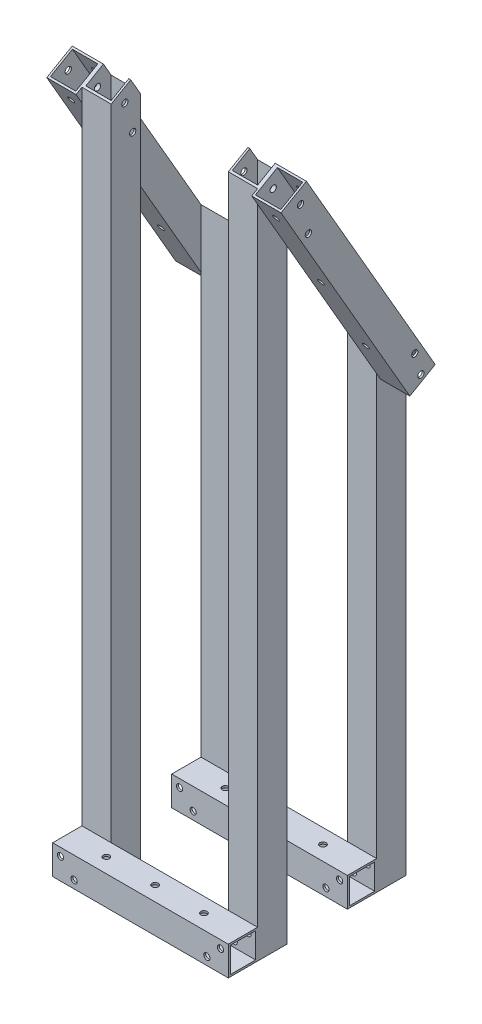
from build123d import *

# Parameters (mm, degrees)
EXTRUDE_START       = -45
EXTRUDE_1_DEPTH     = 15
EXTRUDE_1_2_DEPTH   = 1
EXTRUDE_START_2     = -31
EXTRUDE_1_3_DEPTH   = 1
EXTRUDE_START_3     = 30
EXTRUDE_1_4_DEPTH   = 15
EXTRUDE_1_5_DEPTH   = 1
EXTRUDE_START_4     = 44
EXTRUDE_1_6_DEPTH   = 1
EXTRUDE_1_7_DEPTH   = 15
EXTRUDE_1_8_DEPTH   = 1
EXTRUDE_1_9_DEPTH   = 1
EXTRUDE_1_10_DEPTH  = 15
EXTRUDE_1_11_DEPTH  = 1
EXTRUDE_1_12_DEPTH  = 1
SKETCH_3_W          = 15
SKETCH_3_H          = 15
SKETCH_3_W_2        = 13
SKETCH_3_H_2        = 13
EXTRUDE_3_DEPTH     = 90
SKETCH_4_W          = 15
SKETCH_4_H          = 15.026544659
SKETCH_4_W_2        = 13
SKETCH_4_H_2        = 13
EXTRUDE_4_DEPTH     = 152
SKETCH_6_R          = 1.6
CUT_EXTRUDE_1_DEPTH = 100
SKETCH_7_R          = 1.6
CUT_EXTRUDE_2_DEPTH = 164
SKETCH_8_R          = 1.6
CUT_EXTRUDE_3_DEPTH = 164
SKETCH_9_R          = 1.6
CUT_EXTRUDE_4_DEPTH = 164
SKETCH_10_W         = 243.132653359
SKETCH_10_H         = 148.373260255
CUT_EXTRUDE_5_DEPTH = 20


# Read off the part's stored shape, not the designer's step: 凸台-拉伸1
with BuildPart() as part:
    # 凸台-拉伸1 outline → 凸台-拉伸1 (new body)
    with BuildSketch(Plane.YZ.offset(EXTRUDE_START)):
        Polygon((0, -38), (234.182069312, -38), (235.91412012, -37), (0, -37), align=None)
        Polygon((0, -24), (258.430780618, -24), (260.162831426, -23), (0, -23), align=None)
    extrude(amount=EXTRUDE_1_DEPTH)

    # Extrude 1 2 outline → Extrude 1 2 (add)
    with BuildSketch(Plane.YZ.offset(EXTRUDE_START)):
        Polygon((0, -37), (235.91412012, -37), (258.430780618, -24), (0, -24), align=None)
    extrude(amount=EXTRUDE_1_2_DEPTH)

    # Extrude 1 3 outline → Extrude 1 3 (add)
    with BuildSketch(Plane.YZ.offset(EXTRUDE_START_2)):
        Polygon((0, -37), (235.91412012, -37), (258.430780618, -24), (0, -24), align=None)
    extrude(amount=EXTRUDE_1_3_DEPTH)



with BuildPart() as body_2:
    # Extrude 1 4 outline → Extrude 1 4 (new body)
    with BuildSketch(Plane.YZ.offset(EXTRUDE_START_3)):
        Polygon((365.817930688, 38), (0, 38), (0, 37), (364.08587988, 37), align=None)
        Polygon((341.569219382, 24), (0, 24), (0, 23), (339.837168574, 23), align=None)
    extrude(amount=EXTRUDE_1_4_DEPTH)

    # Extrude 1 5 outline → Extrude 1 5 (add)
    with BuildSketch(Plane.YZ.offset(EXTRUDE_START_3)):
        Polygon((364.08587988, 37), (0, 37), (0, 24), (341.569219382, 24), align=None)
    extrude(amount=EXTRUDE_1_5_DEPTH)

    # Extrude 1 6 outline → Extrude 1 6 (add)
    with BuildSketch(Plane.YZ.offset(EXTRUDE_START_4)):
        Polygon((364.08587988, 37), (0, 37), (0, 24), (341.569219382, 24), align=None)
    extrude(amount=EXTRUDE_1_6_DEPTH)


with BuildPart() as body_3:
    # Extrude 1 7 outline → Extrude 1 7 (new body)
    with BuildSketch(Plane.YZ.offset(EXTRUDE_START)):
        Polygon((0, 23), (339.837168574, 23), (341.569219382, 24), (0, 24), align=None)
        Polygon((0, 37), (364.08587988, 37), (365.817930688, 38), (0, 38), align=None)
    extrude(amount=EXTRUDE_1_7_DEPTH)

    # Extrude 1 8 outline → Extrude 1 8 (add)
    with BuildSketch(Plane.YZ.offset(EXTRUDE_START)):
        Polygon((0, 24), (341.569219382, 24), (364.08587988, 37), (0, 37), align=None)
    extrude(amount=EXTRUDE_1_8_DEPTH)

    # Extrude 1 9 outline → Extrude 1 9 (add)
    with BuildSketch(Plane.YZ.offset(EXTRUDE_START_2)):
        Polygon((0, 24), (341.569219382, 24), (364.08587988, 37), (0, 37), align=None)
    extrude(amount=EXTRUDE_1_9_DEPTH)


with BuildPart() as body_4:
    # Extrude 1 10 outline → Extrude 1 10 (new body)
    with BuildSketch(Plane.YZ.offset(EXTRUDE_START_3)):
        Polygon((260.162831426, -23), (0, -23), (0, -24), (258.430780618, -24), align=None)
        Polygon((235.91412012, -37), (0, -37), (0, -38), (234.182069312, -38), align=None)
    extrude(amount=EXTRUDE_1_10_DEPTH)

    # Extrude 1 11 outline → Extrude 1 11 (add)
    with BuildSketch(Plane.YZ.offset(EXTRUDE_START_3)):
        Polygon((258.430780618, -24), (0, -24), (0, -37), (235.91412012, -37), align=None)
    extrude(amount=EXTRUDE_1_11_DEPTH)

    # Extrude 1 12 outline → Extrude 1 12 (add)
    with BuildSketch(Plane.YZ.offset(EXTRUDE_START_4)):
        Polygon((258.430780618, -24), (0, -24), (0, -37), (235.91412012, -37), align=None)
    extrude(amount=EXTRUDE_1_12_DEPTH)


with BuildPart() as part_1:
    add(part.part)

    add(body_2.part)  # 凸台-拉伸3 merges body 2

    add(body_3.part)  # 凸台-拉伸3 merges body 3

    add(body_4.part)  # 凸台-拉伸3 merges body 4
    # 草图3 → 凸台-拉伸3 (add)
    # profile 1 of 2: a face of its own
    with BuildSketch(Plane(origin=(45, 0, 0), x_dir=(0, 0, -1), z_dir=(1, 0, 0))):
        with Locations((-45.5, 7.5)):
            Rectangle(SKETCH_3_W, SKETCH_3_H)
        with Locations((-45.5, 7.5)):
            Rectangle(SKETCH_3_W_2, SKETCH_3_H_2, mode=Mode.SUBTRACT)
    # profile 2 of 2: a face of its own
    with BuildSketch(Plane(origin=(45, 0, 0), x_dir=(0, 0, -1), z_dir=(1, 0, 0))):
        with Locations((15.5, 7.5)):
            Rectangle(SKETCH_3_W, SKETCH_3_H)
        with Locations((15.5, 7.5)):
            Rectangle(SKETCH_3_W_2, SKETCH_3_H_2, mode=Mode.SUBTRACT)
    extrude(amount=-EXTRUDE_3_DEPTH)

    # 草图4 → 凸台-拉伸4 (add)
    # profile 1 of 2: a face of its own
    with BuildSketch(Plane(origin=(0, 159.182069312, 91.903810568), x_dir=(-1, 0, 0), z_dir=(-2.065061832246786e-15, -0.8660254037844398, -0.499999999999998))):
        with Locations((-52.5, 142.48672767)):
            Rectangle(SKETCH_4_W, SKETCH_4_H)
        with Locations((-52.5, 142.5)):
            Rectangle(SKETCH_4_W_2, SKETCH_4_H_2, mode=Mode.SUBTRACT)
    # profile 2 of 2: a face of its own
    with BuildSketch(Plane(origin=(0, 159.182069312, 91.903810568), x_dir=(-1, 0, 0), z_dir=(-2.065061832246786e-15, -0.8660254037844398, -0.499999999999998))):
        with Locations((52.5, 142.48672767)):
            Rectangle(SKETCH_4_W, SKETCH_4_H)
        with Locations((52.5, 142.5)):
            Rectangle(SKETCH_4_W_2, SKETCH_4_H_2, mode=Mode.SUBTRACT)
    extrude(amount=-EXTRUDE_4_DEPTH)

    # 草图6 → 切除-拉伸1 (cut)
    with BuildSketch(Plane(origin=(0, 0, -38), x_dir=(-1, 0, 0), z_dir=(0, 0, -1))):
        with Locations((-41, 11)):
            Circle(SKETCH_6_R)
        with Locations((-34, 4)):
            Circle(SKETCH_6_R)
        with Locations((34, 4)):
            Circle(SKETCH_6_R)
        with Locations((41, 11)):
            Circle(SKETCH_6_R)
    extrude(amount=-CUT_EXTRUDE_1_DEPTH, mode=Mode.SUBTRACT)

    # 草图7 → 切除-拉伸2 (cut)
    with BuildSketch(Plane(origin=(60, 0, 0), x_dir=(0, 0, -1), z_dir=(1, 0, 0))):
        with Locations(Location((-31.012365625, 339.714992925, 0), (0, 0, 90))):
            Circle(SKETCH_7_R)
        with Locations(Location((-27, 324.726439638, 0), (0, 0, 90))):
            Circle(SKETCH_7_R)
        with Locations(Location((27.521766242, 244.330902554, 0), (0, 0, 90))):
            Circle(SKETCH_7_R)
        with Locations(Location((30.643983768, 233.399172976, 0), (0, 0, 90))):
            Circle(SKETCH_7_R)
    extrude(amount=-CUT_EXTRUDE_2_DEPTH, mode=Mode.SUBTRACT)

    # 草图8 → 切除-拉伸3 (cut)
    with BuildSketch(Plane(origin=(0, 75, -129.903810568), x_dir=(-1, 0, 0), z_dir=(0, 0.49999999999999806, -0.8660254037844398))):
        with Locations(Location((-52.5, 305.807621135, 0), (0, 0, 90))):
            Circle(SKETCH_8_R)
        with Locations(Location((-52.5, 259.807621135, 0), (0, 0, 90))):
            Circle(SKETCH_8_R)
        with Locations(Location((-52.5, 213.807621135, 0), (0, 0, 90))):
            Circle(SKETCH_8_R)
        with Locations(Location((52.5, 213.807621135, 0), (0, 0, 90))):
            Circle(SKETCH_8_R)
        with Locations(Location((52.5, 259.807621135, 0), (0, 0, 90))):
            Circle(SKETCH_8_R)
        with Locations(Location((52.5, 305.807621135, 0), (0, 0, 90))):
            Circle(SKETCH_8_R)
    extrude(amount=-CUT_EXTRUDE_3_DEPTH, mode=Mode.SUBTRACT)

    # 草图9 → 切除-拉伸4 (cut)
    with BuildSketch(Plane.XZ):
        with Locations(Location((-25, -15.5, 0), (0, 0, 270))):
            Circle(SKETCH_9_R)
        with Locations(Location((0, 45.5, 0), (0, 0, 270))):
            Circle(SKETCH_9_R)
        with Locations(Location((25, -15.5, 0), (0, 0, 270))):
            Circle(SKETCH_9_R)
        with Locations(Location((25, 45.5, 0), (0, 0, 270))):
            Circle(SKETCH_9_R)
        with Locations(Location((0, -15.5, 0), (0, 0, 270))):
            Circle(SKETCH_9_R)
        with Locations(Location((-25, 45.5, 0), (0, 0, 270))):
            Circle(SKETCH_9_R)
    extrude(amount=-CUT_EXTRUDE_4_DEPTH, mode=Mode.SUBTRACT)

    # 草图10 → 切除-拉伸5 (cut)
    with BuildSketch(Plane(origin=(0, 290.817930688, 167.903810568), x_dir=(1, 0, 0), z_dir=(2.527654759173932e-15, 0.86602540378444, 0.4999999999999975))):
        with Locations((-2.077772522, 170.318702999)):
            Rectangle(SKETCH_10_W, SKETCH_10_H)
    extrude(amount=-CUT_EXTRUDE_5_DEPTH, mode=Mode.SUBTRACT)


solid = part_1.part
